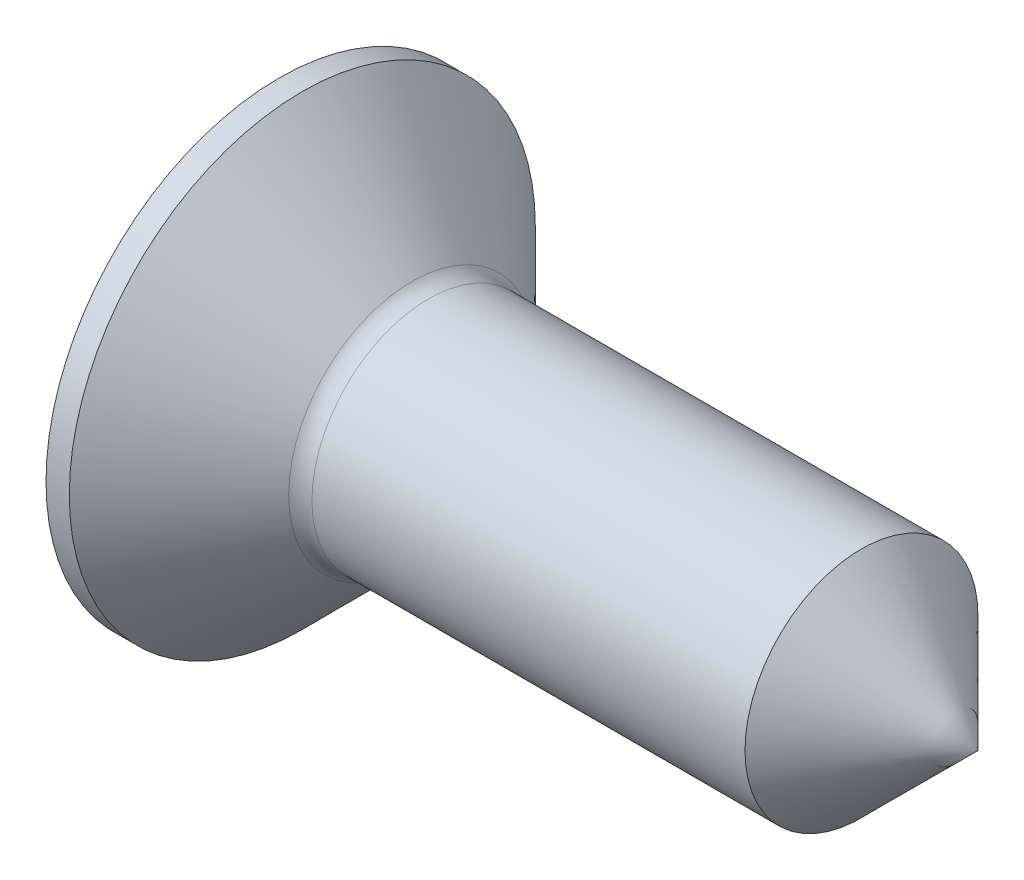
from build123d import *

# Parameters (mm, degrees)
FILLET1_R = 0.2


with BuildPart() as part:
    # Sketch1 → Base (revolve)
    with BuildSketch(Plane(origin=(0, 0, 0), x_dir=(1, 0, 0), z_dir=(0, 1, 0))):
        with BuildLine():
            Line((1.8, 1), (6.6, 1))
            Line((6.6, 1), (6.6, 0))
            Line((6.6, 0), (0, 0))
            ThreePointArc((0, 0), (0.153231164, 1.044030651), (0.6, 2))
            Line((0.6, 2), (0.8, 2))
            Line((0.8, 2), (1.8, 1))
        make_face()
    revolve(axis=Axis((-7.24054878, 0, 0), (1, 0, 0)))

    # Fillet1
    fillet1_edges = [part.edges().sort_by_distance(p)[0] for p in [
        (1.8, 0, 1),
    ]]
    fillet(fillet1_edges, radius=FILLET1_R)

    # Sketch4 → Cut-Revolve1 (revolve, cut)
    with BuildSketch(Plane.XY):
        Polygon((7.21, 0), (7.21, 20), (-13.4, 20), (6.6, 0), align=None)
    revolve(axis=Axis((4.646714036, 0, 0), (1, 0, 0)), mode=Mode.SUBTRACT)

    # Sketch3 → Cut-Loft1 section 0
    with BuildSketch(Plane(origin=(0, 0, 0), x_dir=(0, 0, -1), z_dir=(1, 0, 0)), mode=Mode.PRIVATE) as cut_loft1_s0:
        with BuildLine():
            Line((-0.3375, 0.3375), (-1.35, 0.3375))
            Line((-1.35, 0.3375), (-1.35, -0.3375))
            Line((-1.35, -0.3375), (-0.3375, -0.3375))
            Line((-0.3375, -0.3375), (-0.3375, -1.35))
            Line((-0.3375, -1.35), (0.3375, -1.35))
            Line((0.3375, -1.35), (0.3375, -0.3375))
            Line((0.3375, -0.3375), (1.35, -0.3375))
            Line((1.35, -0.3375), (1.35, 0.3375))
            Line((1.35, 0.3375), (0.3375, 0.3375))
            Line((0.3375, 0.3375), (0.3375, 1.35))
            Line((0.3375, 1.35), (-0.3375, 1.35))
            Line((-0.3375, 1.35), (-0.3375, 0.3375))
        make_face()
    loft([cut_loft1_s0.sketch, Vertex(1.65, 0, 0)], mode=Mode.SUBTRACT)


solid = part.part
